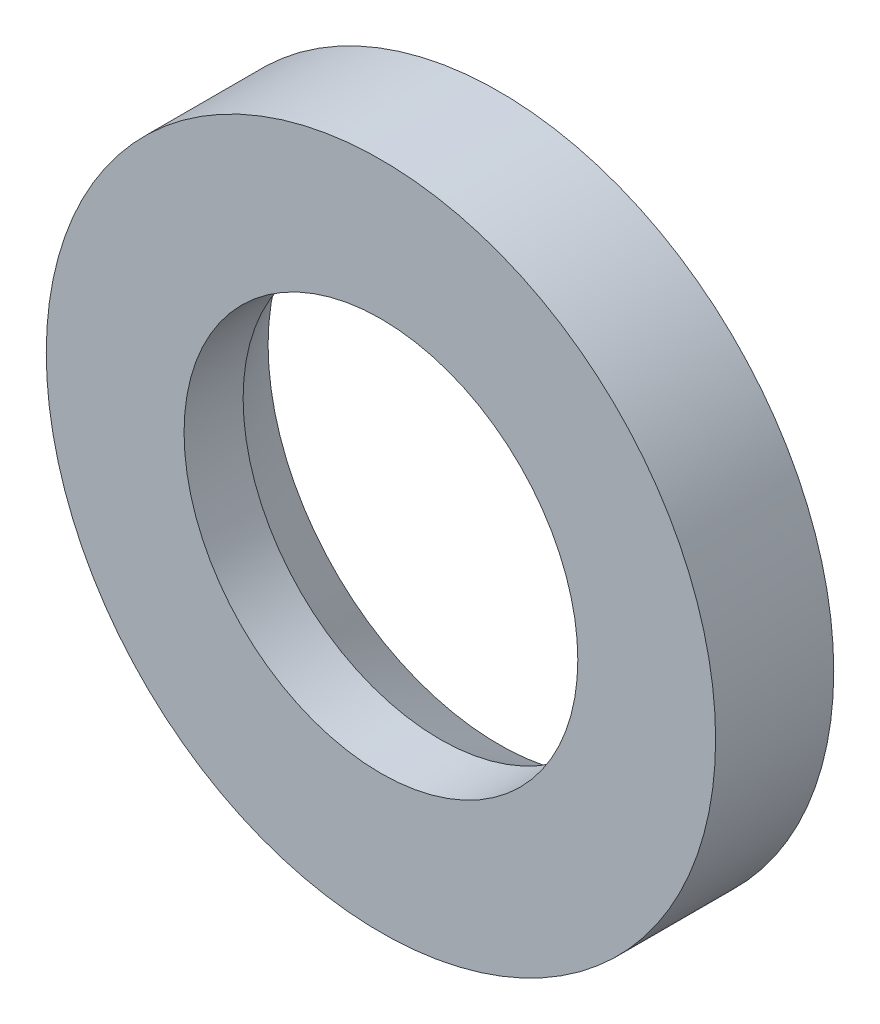
from build123d import *

# Parameters (mm, degrees)
SKETCH1_R           = 1.7
BOSS_EXTRUDE1_DEPTH = 0.6
SKETCH2_R           = 1
CUT_EXTRUDE1_DEPTH  = 3.477902339
CHAMFER1_SIZE       = 0.3
CHAMFER1_SIZE2      = 0.173205081


with BuildPart() as part:
    # Sketch1 → Boss-Extrude1 (new body)
    with BuildSketch(Plane.XY):
        Circle(SKETCH1_R)
    extrude(amount=-BOSS_EXTRUDE1_DEPTH)

    # Sketch2 → Cut-Extrude1 (cut, through all)
    with BuildSketch(Plane.XY):
        Circle(SKETCH2_R)
    extrude(amount=-CUT_EXTRUDE1_DEPTH, mode=Mode.SUBTRACT)

    # Chamfer1
    chamfer1_edges = [part.edges().sort_by_distance(p)[0] for p in [
        (-1, 0, -0.6),
    ]]
    chamfer1_side = [part.faces().sort_by_distance(p)[0] for p in [
        (-1, 0, -0.3),
    ]]
    chamfer(chamfer1_edges, length=CHAMFER1_SIZE, length2=CHAMFER1_SIZE2, reference=chamfer1_side[0])


solid = part.part
